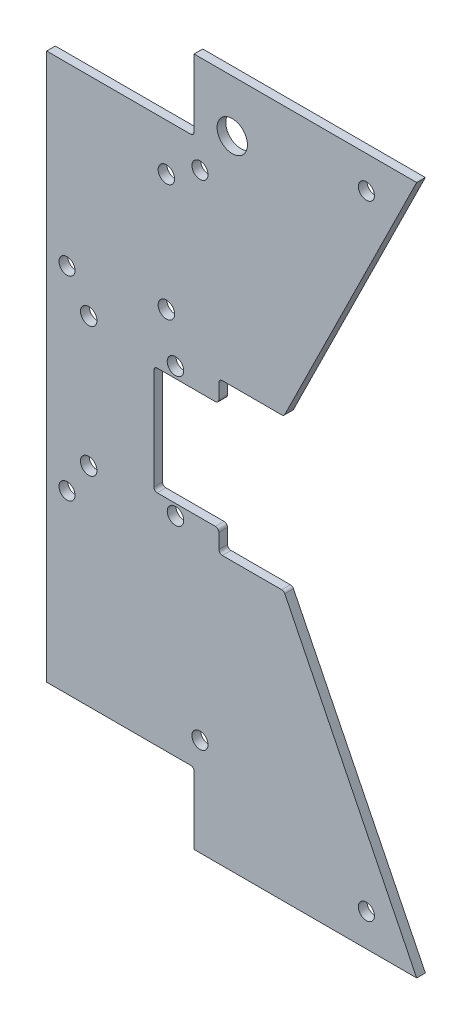
from build123d import *

# Parameters (mm, degrees)
SKETCH1_R           = 2.3495
SKETCH1_R_2         = 4.445
BOSS_EXTRUDE1_DEPTH = 2.54
SKETCH2_R           = 2.413
CUT_EXTRUDE1_DEPTH  = 217.884748371
SKETCH3_W           = 19.05
SKETCH3_H           = 31.623
CUT_EXTRUDE2_DEPTH  = 217.884748371
SKETCH4_W           = 12.77569874
SKETCH4_H           = 24.435209008
SKETCH4_W_2         = 40.233428475
SKETCH4_H_2         = 28.333759116
CUT_EXTRUDE3_DEPTH  = 217.884748371
SKETCH5_R           = 2.413
CUT_EXTRUDE4_DEPTH  = 217.884748371
SKETCH6_W           = 9.708241826
SKETCH6_H           = 160.02
CUT_EXTRUDE5_DEPTH  = 217.884748371
FILLET1_R           = 1
FILLET2_R           = 1


with BuildPart() as part:
    # Sketch1 → Boss-Extrude1 (new body)
    with BuildSketch(Plane.XY):
        Polygon((-2.930050059, -104.509781075), (-3.314938219, -104.509781075), (-3.314938219, -110.859781075), (-3.314938219, -123.559781075), (-2.930050059, -123.559781075), (-2.930050059, -168.708281075), (38.709428475, -168.708281075), (38.709428475, -189.536281075), (105.397061781, -189.536281075), (66.517436481, -110.859781075), (47.485061781, -110.859781075), (47.485061781, -104.509781075), (47.485061781, -72.886781075), (47.485061781, -66.536781075), (66.517436481, -66.536781075), (105.397061781, 12.139718925), (38.709428475, 12.139718925), (38.709428475, -8.688281075), (-2.930050059, -8.688281075), (-2.930050059, -53.836781075), (-3.314938219, -53.836781075), (-3.314938219, -66.536781075), (-3.314938219, -72.886781075), (-2.930050059, -72.886781075), align=None)
        with Locations((90.673911143, 2.614718925)):
            Circle(SKETCH1_R, mode=Mode.SUBTRACT)
        with Locations((41.95655448, -16.435281075)):
            Circle(SKETCH1_R, mode=Mode.SUBTRACT)
        with Locations((3.035061781, -60.186781075)):
            Circle(SKETCH1_R, mode=Mode.SUBTRACT)
        with Locations((3.035061781, -117.209781075)):
            Circle(SKETCH1_R, mode=Mode.SUBTRACT)
        with Locations((41.95655448, -160.961281075)):
            Circle(SKETCH1_R, mode=Mode.SUBTRACT)
        with Locations((90.673911143, -180.011281075)):
            Circle(SKETCH1_R, mode=Mode.SUBTRACT)
        with Locations((51.409428475, -3.100281075)):
            Circle(SKETCH1_R_2, mode=Mode.SUBTRACT)
    extrude(amount=BOSS_EXTRUDE1_DEPTH)

    # Sketch2 → Cut-Extrude1 (cut, through all)
    with BuildSketch(Plane.XY.offset(2.54)):
        with Locations((9.385061781, -69.711781075)):
            Circle(SKETCH2_R)
        with Locations((34.785061781, -69.711781075)):
            Circle(SKETCH2_R)
        with Locations((34.785061781, -107.684781075)):
            Circle(SKETCH2_R)
        with Locations((9.385061781, -107.684781075)):
            Circle(SKETCH2_R)
    extrude(amount=-CUT_EXTRUDE1_DEPTH, mode=Mode.SUBTRACT)

    # Sketch3 → Cut-Extrude2 (cut, through all)
    with BuildSketch(Plane.XY.offset(2.54)):
        with Locations((37.960061781, -88.698281075)):
            Rectangle(SKETCH3_W, SKETCH3_H)
    extrude(amount=-CUT_EXTRUDE2_DEPTH, mode=Mode.SUBTRACT)

    # Sketch4 → Cut-Extrude3 (cut, through all)
    with BuildSketch(Plane.XY.offset(2.54)):
        with Locations((33.845579105, 3.529323429)):
            Rectangle(SKETCH4_W, SKETCH4_H)
        with Locations((20.116714238, -182.875160633)):
            Rectangle(SKETCH4_W_2, SKETCH4_H_2)
    extrude(amount=-CUT_EXTRUDE3_DEPTH, mode=Mode.SUBTRACT)

    # Sketch5 → Cut-Extrude4 (cut, through all)
    with BuildSketch(Plane(origin=(0, 0, 0), x_dir=(-1, 0, 0), z_dir=(0, 0, -1))):
        with Locations((-32.121949941, -22.404281075)):
            Circle(SKETCH5_R)
        with Locations((-32.121949941, -56.694281075)):
            Circle(SKETCH5_R)
    extrude(amount=-CUT_EXTRUDE4_DEPTH, mode=Mode.SUBTRACT)

    # Sketch6 → Cut-Extrude5 (cut, through all)
    with BuildSketch(Plane(origin=(0, 0, 0), x_dir=(-1, 0, 0), z_dir=(0, 0, -1))):
        with Locations((7.784170972, -88.698281075)):
            Rectangle(SKETCH6_W, SKETCH6_H)
    extrude(amount=-CUT_EXTRUDE5_DEPTH, mode=Mode.SUBTRACT)

    # Fillet1
    fillet1_edges = [part.edges().sort_by_distance(p)[0] for p in [
        (66.517436481, -66.536781075, 1.27),
        (47.485061781, -66.536781075, 1.27),
        (28.435061781, -72.886781075, 1.27),
        (66.517436481, -110.859781075, 1.27),
        (28.435061781, -104.509781075, 1.27),
        (47.485061781, -110.859781075, 1.27),
        (40.233428475, -168.708281075, 1.27),
        (40.233428475, -8.688281075, 1.27),
    ]]
    fillet(fillet1_edges, radius=FILLET1_R)

    # Fillet2
    fillet2_edges = [part.edges().sort_by_distance(p)[0] for p in [
        (47.485061781, -104.509781075, 1.27),
        (47.485061781, -72.886781075, 1.27),
    ]]
    fillet(fillet2_edges, radius=FILLET2_R)


solid = part.part
